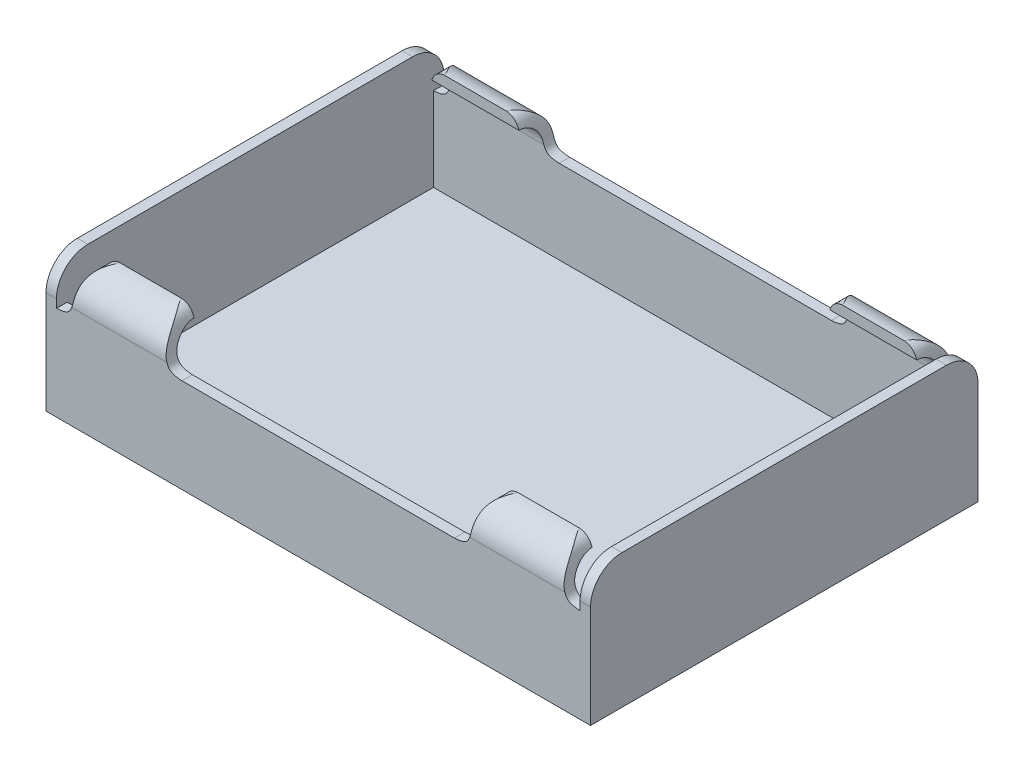
from build123d import *

# Parameters (mm, degrees)
SKETCH1_W               = 52
SKETCH1_H               = 37
BOSS_EXTRUDE1_DEPTH     = 12.8
FILLET1_R               = 3
SHELL2_START            = -25
SHELL2_DEPTH            = 50
CUT_EXTRUDE1_DEPTH      = 47.998297842
CUT_EXTRUDE1_DEPTH_BACK = 47.998297842


# Read off the part's stored shape, not the designer's step: Shell2
with BuildPart() as part:
    # Sketch1 → Boss-Extrude1 (new body)
    with BuildSketch(Plane(origin=(0, 0, 0), x_dir=(1, 0, 0), z_dir=(0, 1, 0))):
        Rectangle(SKETCH1_W, SKETCH1_H)
    extrude(amount=BOSS_EXTRUDE1_DEPTH)

    # Fillet1
    fillet1_edges = [part.edges().sort_by_distance(p)[0] for p in [
        (0, 12.8, -18.5),
        (0, 12.8, 18.5),
    ]]
    fillet(fillet1_edges, radius=FILLET1_R)

    # Shell2 outline → Shell2 (cut)
    with BuildSketch(Plane.YZ.offset(SHELL2_START)):
        with BuildLine():
            Line((12.8, 15.5), (11.8, 15.5))
            ThreePointArc((11.8, 15.5), (11.214213562, 16.914213562), (9.8, 17.5))
            Line((9.8, 17.5), (1, 17.5))
            Line((1, 17.5), (1, -17.5))
            Line((1, -17.5), (9.8, -17.5))
            ThreePointArc((9.8, -17.5), (11.214213562, -16.914213562), (11.8, -15.5))
            Line((11.8, -15.5), (12.8, -15.5))
            Line((12.8, -15.5), (12.8, 15.5))
        make_face()
    extrude(amount=SHELL2_DEPTH, mode=Mode.SUBTRACT)

    # Sketch2 → Cut-Extrude1 (cut, two sides: drawn at the far end of the back side and taken through both)
    with BuildSketch(Plane.XY.offset(18.5).offset(-CUT_EXTRUDE1_DEPTH_BACK)):
        with BuildLine():
            Line((-25, 9), (-25, 12.8))
            Line((-25, 12.8), (-22, 12.8))
            add(Edge.make_bspline(
                [(-25, 9), (-24.337551865, 9.035956423), (-22.850759104, 9.461520311), (-23.745938666, 12.539955656), (-22, 12.8)],
                knots=[0, 0, 0, 0, 0.249396221, 1, 1, 1, 1], degree=3))
        make_face()
        with BuildLine():
            Line((-16, 12.8), (16, 12.8))
            add(Edge.make_bspline(
                [(13, 9), (13.662448135, 9.035956423), (15.149240896, 9.461520311), (14.254061334, 12.539955656), (16, 12.8)],
                knots=[0, 0, 0, 0, 0.249396221, 1, 1, 1, 1], degree=3))
            Line((13, 9), (-13, 9))
            add(Edge.make_bspline(
                [(-13, 9), (-13.662448135, 9.035956423), (-15.149240896, 9.461520311), (-14.254061334, 12.539955656), (-16, 12.8)],
                knots=[0, 0, 0, 0, 0.249396221, 1, 1, 1, 1], degree=3))
        make_face()
        with BuildLine():
            Line((25, 9), (25, 12.8))
            Line((25, 12.8), (22, 12.8))
            add(Edge.make_bspline(
                [(25, 9), (24.337551865, 9.035956423), (22.850759104, 9.461520311), (23.745938666, 12.539955656), (22, 12.8)],
                knots=[0, 0, 0, 0, 0.249396221, 1, 1, 1, 1], degree=3))
        make_face()
    extrude(amount=CUT_EXTRUDE1_DEPTH + CUT_EXTRUDE1_DEPTH_BACK, mode=Mode.SUBTRACT)


solid = part.part
